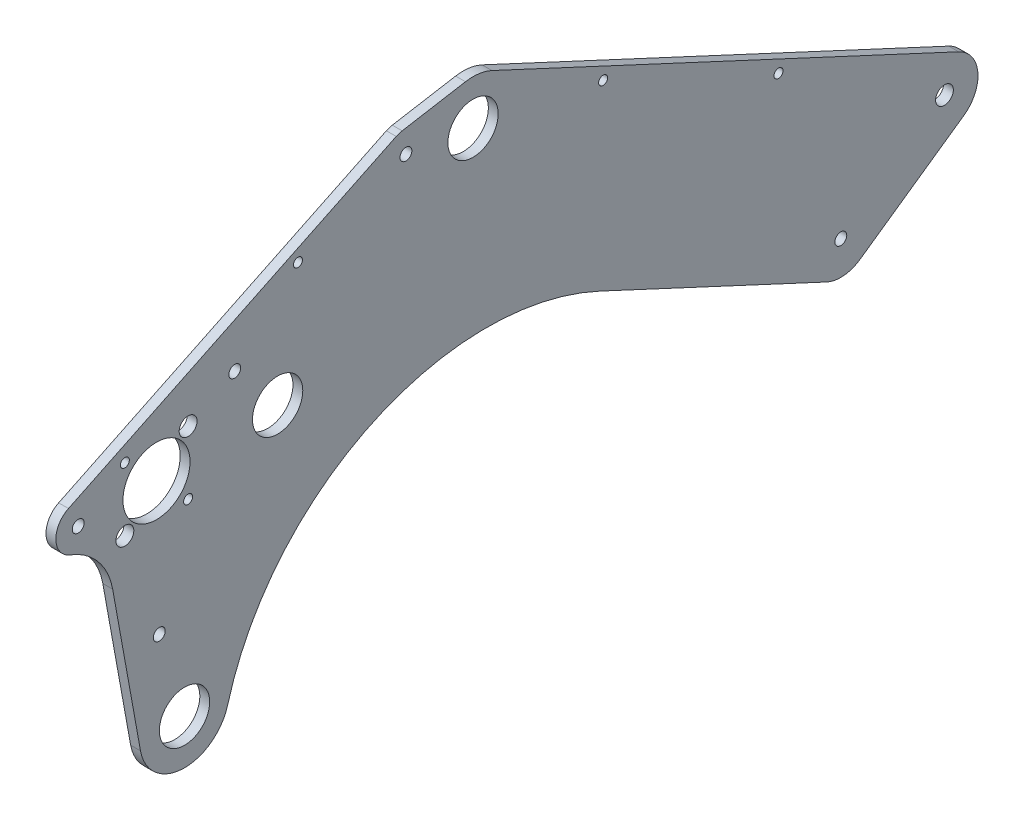
from build123d import *

# Parameters (mm, degrees)
SKETCH2_R           = 14.2875
SKETCH2_R_2         = 19.05
SKETCH2_R_3         = 5.0419
SKETCH2_R_4         = 3.3782
SKETCH2_R_5         = 5.08
SKETCH2_R_6         = 2.5527
BOSS_EXTRUDE1_DEPTH = 5.588
SKETCH4_R           = 2.5527
CUT_EXTRUDE1_DEPTH  = 525.439224715


with BuildPart() as part:
    # Sketch2 → Boss-Extrude1 (new body)
    with BuildSketch(Plane(origin=(0, 0, 0), x_dir=(0, 0, -1), z_dir=(1, 0, 0))):
        with BuildLine():
            Line((-456.48850784, -94.216879065), (-472.304252435, -6.793143068))
            ThreePointArc((-472.304252435, -6.793143068), (-480.519773369, 10.807330335), (-496.344062396, 22.070692401))
            ThreePointArc((-496.344062396, 22.070692401), (-504.547547718, 33.386295155), (-497.38523862, 45.388018594))
            Line((-497.38523862, 45.388018594), (-311.296817221, 135.298775529))
            ThreePointArc((-311.296817221, 135.298775529), (-309.645820095, 135.958272101), (-307.918904928, 136.380754341))
            Line((-307.918904928, 136.380754341), (-271.966041533, 142.54793471))
            ThreePointArc((-271.966041533, 142.54793471), (-264.309456429, 142.690048282), (-256.958497387, 140.543680915))
            Line((-256.958497387, 140.543680915), (8.034953202, 17.272580208))
            ThreePointArc((8.034953202, 17.272580208), (18.976741442, 1.669066884), (10.926631112, -15.604846444))
            Line((10.926631112, -15.604846444), (-47.922930166, -56.811752871))
            ThreePointArc((-47.922930166, -56.811752871), (-57.180494395, -60.183647869), (-66.88451448, -58.479486636))
            Line((-66.88451448, -58.479486636), (-195.744868891, 1.464476849))
            ThreePointArc((-195.744868891, 1.464476849), (-324.091383085, 1.56323997), (-406.998547087, -96.412469352))
            ThreePointArc((-406.998547087, -96.412469352), (-432.619969884, -115.070227521), (-456.48850784, -94.216879065))
        make_face()
        with Locations((-267.671768323, 117.513573971)):
            Circle(SKETCH2_R, mode=Mode.SUBTRACT)
        with Locations((-378.637027713, 36.879761335)):
            Circle(SKETCH2_R, mode=Mode.SUBTRACT)
        with Locations((-431.494222517, -89.695186775)):
            Circle(SKETCH2_R, mode=Mode.SUBTRACT)
        with Locations((-447.410189721, 33.952817036)):
            Circle(SKETCH2_R_2, mode=Mode.SUBTRACT)
        Circle(SKETCH2_R_3, mode=Mode.SUBTRACT)
        with Locations((-58.849561279, -41.206906428)):
            Circle(SKETCH2_R_4, mode=Mode.SUBTRACT)
        with Locations((-305.771768323, 123.863573971)):
            Circle(SKETCH2_R_4, mode=Mode.SUBTRACT)
        with Locations((-429.449677479, 51.913329278)):
            Circle(SKETCH2_R_5, mode=Mode.SUBTRACT)
        with Locations((-465.370701963, 51.913329278)):
            Circle(SKETCH2_R_6, mode=Mode.SUBTRACT)
        with Locations((-465.370701963, 15.992304794)):
            Circle(SKETCH2_R_5, mode=Mode.SUBTRACT)
        with Locations((-429.449677479, 15.992304794)):
            Circle(SKETCH2_R_6, mode=Mode.SUBTRACT)
        with Locations((-491.860189721, 33.952817036)):
            Circle(SKETCH2_R_4, mode=Mode.SUBTRACT)
        with Locations((-445.822689721, -42.247182964)):
            Circle(SKETCH2_R_4, mode=Mode.SUBTRACT)
        with Locations((-402.960189721, 65.702817036)):
            Circle(SKETCH2_R_4, mode=Mode.SUBTRACT)
    extrude(amount=BOSS_EXTRUDE1_DEPTH)

    # Sketch4 → Cut-Extrude1 (cut, through all)
    with BuildSketch(Plane(origin=(5.588, 0, 0), x_dir=(0, 0, -1), z_dir=(1, 0, 0))):
        with Locations((-367.103824439, 101.282633197)):
            Circle(SKETCH4_R)
        with Locations((-193.805945308, 104.1625906)):
            Circle(SKETCH4_R)
        with Locations((-94.22465492, 57.838822036)):
            Circle(SKETCH4_R)
    extrude(amount=-CUT_EXTRUDE1_DEPTH, mode=Mode.SUBTRACT)


solid = part.part
